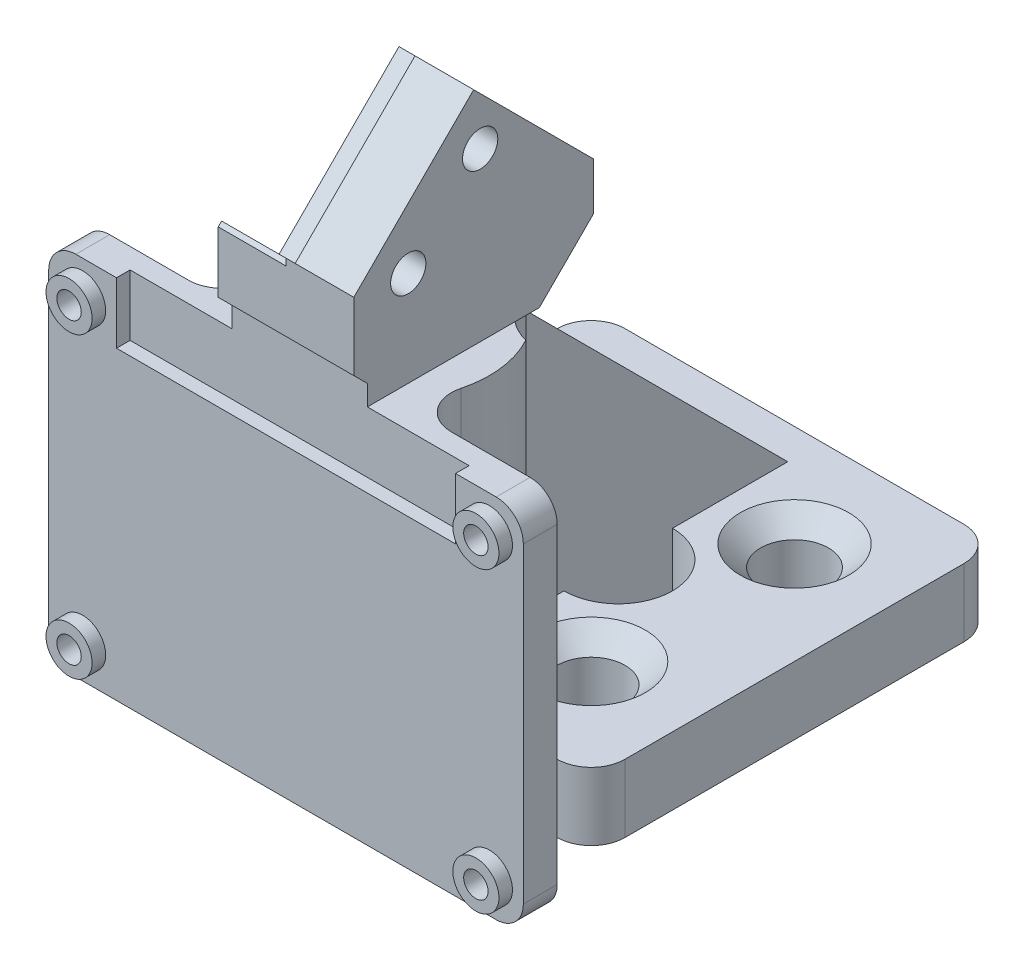
from build123d import *

# Parameters (mm, degrees)
SKETCH1_R           = 15
BOSS_EXTRUDE1_DEPTH = 54
BOSS_EXTRUDE2_DEPTH = 10
SKETCH4_W           = 12.7
SKETCH4_H           = 25
CUT_EXTRUDE2_DEPTH  = 12.7
CHAMFER1_SIZE       = 1
CHAMFER1_SIZE2      = 0.707106781
SKETCH6_R           = 2.6
CUT_EXTRUDE3_DEPTH  = 93.478960977
SKETCH7_R           = 1.8
BOSS_EXTRUDE4_DEPTH = 5
FILLET1_R           = 5
SKETCH8_W           = 60
SKETCH8_H           = 60
BOSS_EXTRUDE5_DEPTH = 10
BOSS_EXTRUDE6_DEPTH = 4
FILLET2_R           = 5
SKETCH10_R          = 5
CUT_EXTRUDE4_DEPTH  = 104.462384491
CHAMFER2_SIZE       = 8
EXTRUDE_THIN1_START = 2
SKETCH11_R          = 3.4
SKETCH11_R_2        = 1.8
EXTRUDE_THIN1_DEPTH = 2
SKETCH12_W          = 50
SKETCH12_H          = 14
CUT_EXTRUDE5_DEPTH  = 2
CHAMFER3_SIZE       = 2
CUT_EXTRUDE6_DEPTH  = 2
SKETCH14_R          = 8
CUT_EXTRUDE7_DEPTH  = 44
CHAMFER4_SIZE       = 3
CUT_EXTRUDE8_DEPTH  = 104.462384491
SKETCH26_R          = 2.5
CUT_EXTRUDE16_DEPTH = 37
CUT_EXTRUDE17_DEPTH = 9
CHAMFER6_SIZE       = 3
SKETCH29_W          = 1.35
SKETCH29_H          = 25
CUT_EXTRUDE18_DEPTH = 12.7


# Some blends are built 0.0001 mm under size
with BuildPart() as part:
    # Sketch1 → Boss-Extrude1 (new body)
    with BuildSketch(Plane(origin=(0, 0, 0), x_dir=(1, 0, 0), z_dir=(0, 1, 0))):
        with Locations(Location((0, 0, 0), (0, 0, 270))):
            Circle(SKETCH1_R)
    extrude(amount=BOSS_EXTRUDE1_DEPTH)

    # Sketch2 → Boss-Extrude2 (add, symmetric)
    with BuildSketch(Plane(origin=(0, 0, 0), x_dir=(0, 0, -1), z_dir=(1, 0, 0))):
        Polygon((-15, 54), (20.355339059, 54), (20.355339059, 69), (2.67766953, 86.67766953), (-15, 69), align=None)
    extrude(amount=BOSS_EXTRUDE2_DEPTH, both=True)

    # Sketch4 → Cut-Extrude2 (cut)
    with BuildSketch(Plane(origin=(0, 42, 42), x_dir=(1, 0, 0), z_dir=(0, 0.7071067811865467, 0.7071067811865485))):
        with Locations((-6.35, 50.683766184)):
            Rectangle(SKETCH4_W, SKETCH4_H)
    extrude(amount=-CUT_EXTRUDE2_DEPTH, mode=Mode.SUBTRACT)

    # Chamfer1
    chamfer1_edges = [part.edges().sort_by_distance(p)[0] for p in [
        (-5, 69, 15),
    ]]
    chamfer1_side = [part.faces().sort_by_distance(p)[0] for p in [
        (0, 61.5, 15),
    ]]
    chamfer(chamfer1_edges, length=CHAMFER1_SIZE, length2=CHAMFER1_SIZE2, reference=chamfer1_side[0])

    # Sketch6 → Cut-Extrude3 (cut, through all)
    with BuildSketch(Plane(origin=(10, 0, 0), x_dir=(0, 0, -1), z_dir=(1, 0, 0))):
        with Locations((3.632263684, 78.652007563)):
            Circle(SKETCH6_R)
        with Locations((-6.974338034, 68.045405845)):
            Circle(SKETCH6_R)
    extrude(amount=-CUT_EXTRUDE3_DEPTH, mode=Mode.SUBTRACT)

    # Sketch7 → Boss-Extrude4 (add)
    with BuildSketch(Plane.XY.offset(15)):
        with BuildLine():
            Line((-31, 0), (31, 0))
            ThreePointArc((31, 0), (33.828427125, 1.171572875), (35, 4))
            Line((35, 4), (35, 50))
            ThreePointArc((35, 50), (33.828427125, 52.828427125), (31, 54))
            Line((31, 54), (-31, 54))
            ThreePointArc((-31, 54), (-33.828427125, 52.828427125), (-35, 50))
            Line((-35, 50), (-35, 4))
            ThreePointArc((-35, 4), (-33.828427125, 1.171572875), (-31, 0))
        make_face()
        with Locations((-30, 49)):
            Circle(SKETCH7_R, mode=Mode.SUBTRACT)
        with Locations((30, 49)):
            Circle(SKETCH7_R, mode=Mode.SUBTRACT)
        with Locations((30, 5)):
            Circle(SKETCH7_R, mode=Mode.SUBTRACT)
        with Locations((-30, 5)):
            Circle(SKETCH7_R, mode=Mode.SUBTRACT)
    extrude(amount=-BOSS_EXTRUDE4_DEPTH)

    # Fillet1
    fillet1_edges = [part.edges().sort_by_distance(p)[0] for p in [
        (11.180339887, 27, 10),
        (-11.180339887, 27, 10),
    ]]
    fillet(fillet1_edges, radius=FILLET1_R)

    # Sketch8 → Boss-Extrude5 (add)
    with BuildSketch(Plane.XZ):
        with Locations((0, -30)):
            Rectangle(SKETCH8_W, SKETCH8_H)
    extrude(amount=-BOSS_EXTRUDE5_DEPTH)

    # Sketch9 → Boss-Extrude6 (add, symmetric)
    with BuildSketch(Plane(origin=(0, 0, 0), x_dir=(0, 0, -1), z_dir=(1, 0, 0))):
        Polygon((15, 50), (55, 10), (10, 10), (10, 50), align=None)
    extrude(amount=BOSS_EXTRUDE6_DEPTH, both=True)

    # Fillet2
    fillet2_edges = [part.edges().sort_by_distance(p)[0] for p in [
        (-30, 5, 0),
        (30, 5, 0),
        (30, 5, -60),
        (-30, 5, -60),
    ]]
    fillet(fillet2_edges, radius=FILLET2_R)

    # Sketch10 → Cut-Extrude4 (cut, through all)
    with BuildSketch(Plane(origin=(0, 10, 0), x_dir=(1, 0, 0), z_dir=(0, 1, 0))):
        with Locations(Location((15, 45, 0), (0, 0, 270))):
            Circle(SKETCH10_R)
        with Locations(Location((-15, 45, 0), (0, 0, 270))):
            Circle(SKETCH10_R)
        with Locations(Location((-15, 15, 0), (0, 0, 270))):
            Circle(SKETCH10_R)
        with Locations(Location((15, 15, 0), (0, 0, 270))):
            Circle(SKETCH10_R)
    extrude(amount=-CUT_EXTRUDE4_DEPTH, mode=Mode.SUBTRACT)

    # Chamfer2
    # the kernel refuses this chamfer: 8 mm, written as the material it takes off along each edge
    with BuildSketch(Plane(origin=(-30.573463904, 54, -20.355339059), x_dir=(0, -0.027495876610586487, 0.9996219169112968), z_dir=(1, 0, 0))) as chamfer2_piece_1_section:
        Polygon((CHAMFER2_SIZE * 0.999621916911, -CHAMFER2_SIZE * 0.0274958766106), (-CHAMFER2_SIZE * 0.0274958766106, -CHAMFER2_SIZE * 0.999621916911), (0, 0), align=None)
    chamfer2_piece_1 = extrude(amount=61.146927807, mode=Mode.PRIVATE)
    chamfer2_piece_1 = chamfer2_piece_1 - Plane(origin=(0, 56.680646847, 0), x_dir=(0, 0, 1), z_dir=(0, -1, 0)) * Cylinder(15, 155, mode=Mode.PRIVATE)
    add(chamfer2_piece_1, mode=Mode.SUBTRACT)

    # Sketch11 → Extrude-Thin1 (add)
    # profile 1 of 4: a face of its own
    with BuildSketch(Plane.XY.offset(15).offset(EXTRUDE_THIN1_START)):
        with Locations((-30, 49)):
            Circle(SKETCH11_R)
        with Locations((-30, 49)):
            Circle(SKETCH11_R_2, mode=Mode.SUBTRACT)
    # profile 2 of 4: a face of its own
    with BuildSketch(Plane.XY.offset(15).offset(EXTRUDE_THIN1_START)):
        with Locations((30, 49)):
            Circle(SKETCH11_R)
        with Locations((30, 49)):
            Circle(SKETCH11_R_2, mode=Mode.SUBTRACT)
    # profile 3 of 4: a face of its own
    with BuildSketch(Plane.XY.offset(15).offset(EXTRUDE_THIN1_START)):
        with Locations((30, 5)):
            Circle(SKETCH11_R)
        with Locations((30, 5)):
            Circle(SKETCH11_R_2, mode=Mode.SUBTRACT)
    # profile 4 of 4: a face of its own
    with BuildSketch(Plane.XY.offset(15).offset(EXTRUDE_THIN1_START)):
        with Locations((-30, 5)):
            Circle(SKETCH11_R)
        with Locations((-30, 5)):
            Circle(SKETCH11_R_2, mode=Mode.SUBTRACT)
    extrude(amount=-EXTRUDE_THIN1_DEPTH)

    # Sketch12 → Cut-Extrude5 (cut)
    with BuildSketch(Plane.XY.offset(15)):
        with Locations((0, 52)):
            Rectangle(SKETCH12_W, SKETCH12_H)
    extrude(amount=-CUT_EXTRUDE5_DEPTH, mode=Mode.SUBTRACT)

    # Chamfer3
    chamfer3_edges = [part.edges().sort_by_distance(p)[0] for p in [
        (0, 59, 13),
    ]]
    chamfer(chamfer3_edges, length=CHAMFER3_SIZE - 0.0001)  # a hair under: the kernel refuses the full size

    # Sketch13 → Cut-Extrude6 (cut)
    with BuildSketch(Plane(origin=(0, 0, 10), x_dir=(-1, 0, 0), z_dir=(0, 0, -1))):
        Polygon((-30, 45.882308546), (-27.3, 47.441154273), (-27.3, 50.558845727), (-30, 52.117691454), (-32.7, 50.558845727), (-32.7, 47.441154273), align=None)
        Polygon((30, 45.882308546), (32.7, 47.441154273), (32.7, 50.558845727), (30, 52.117691454), (27.3, 50.558845727), (27.3, 47.441154273), align=None)
        Polygon((27.3, 6.558845727), (27.3, 3.441154273), (30, 1.882308546), (32.7, 3.441154273), (32.7, 6.558845727), (30, 8.117691454), align=None)
        Polygon((-32.7, 6.558845727), (-32.7, 3.441154273), (-30, 1.882308546), (-27.3, 3.441154273), (-27.3, 6.558845727), (-30, 8.117691454), align=None)
    extrude(amount=-CUT_EXTRUDE6_DEPTH, mode=Mode.SUBTRACT)

    # Sketch14 → Cut-Extrude7 (cut)
    with BuildSketch(Plane(origin=(0, 10, 0), x_dir=(1, 0, 0), z_dir=(0, 1, 0))):
        with Locations((15, 15)):
            Circle(SKETCH14_R)
        with Locations((-15, 15)):
            Circle(SKETCH14_R)
    extrude(amount=CUT_EXTRUDE7_DEPTH, mode=Mode.SUBTRACT)

    # Chamfer4
    chamfer4_edges = [part.edges().sort_by_distance(p)[0] for p in [
        (15, 10, -20),
        (-15, 10, -20),
        (-15, 10, -50),
        (15, 10, -50),
    ]]
    chamfer(chamfer4_edges, length=CHAMFER4_SIZE - 0.0001)  # a hair under: the kernel refuses the full size

    # Sketch15 → Cut-Extrude8 (cut, through all)
    with BuildSketch(Plane(origin=(0, 10, 0), x_dir=(1, 0, 0), z_dir=(0, 1, 0))):
        with BuildLine():
            Line((4, 22), (4, 38))
            ThreePointArc((4, 38), (12, 30), (4, 22))
        make_face()
    extrude(amount=-CUT_EXTRUDE8_DEPTH, mode=Mode.SUBTRACT)

    # Sketch26 → Cut-Extrude16 (cut)
    with BuildSketch(Plane(origin=(0, 33.019743879, 33.019743879), x_dir=(1, 0, 0), z_dir=(0, 0.7071067811865466, 0.7071067811865485))):
        with Locations(Location((-5, 58.183766184, 0), (0, 0, 270))):
            Circle(SKETCH26_R)
        with Locations(Location((-5, 43.183766184, 0), (0, 0, 270))):
            Circle(SKETCH26_R)
    extrude(amount=-CUT_EXTRUDE16_DEPTH, mode=Mode.SUBTRACT)

    # Sketch27 → Cut-Extrude17 (cut)
    with BuildSketch(Plane.ZY.offset(10)):
        Polygon((-20.355339059, 62), (-6.17766953, 47.82233047), (-27.390872965, 26.609127035), (-41.568542495, 40.786796564), align=None)
    extrude(amount=-CUT_EXTRUDE17_DEPTH, mode=Mode.SUBTRACT)

    # Chamfer6
    chamfer6_edges = [part.edges().sort_by_distance(p)[0] for p in [
        (-4, 29.359127035, -30.140872965),
    ]]
    chamfer(chamfer6_edges, length=CHAMFER6_SIZE - 0.0001)  # a hair under: the kernel refuses the full size

    # Sketch29 → Cut-Extrude18 (cut)
    with BuildSketch(Plane(origin=(0, 42, 42), x_dir=(1, 0, 0), z_dir=(0, 0.7071067811865461, 0.7071067811865489))):
        with Locations((0.675, 50.683766184)):
            Rectangle(SKETCH29_W, SKETCH29_H)
    extrude(amount=-CUT_EXTRUDE18_DEPTH, mode=Mode.SUBTRACT)


solid = part.part
